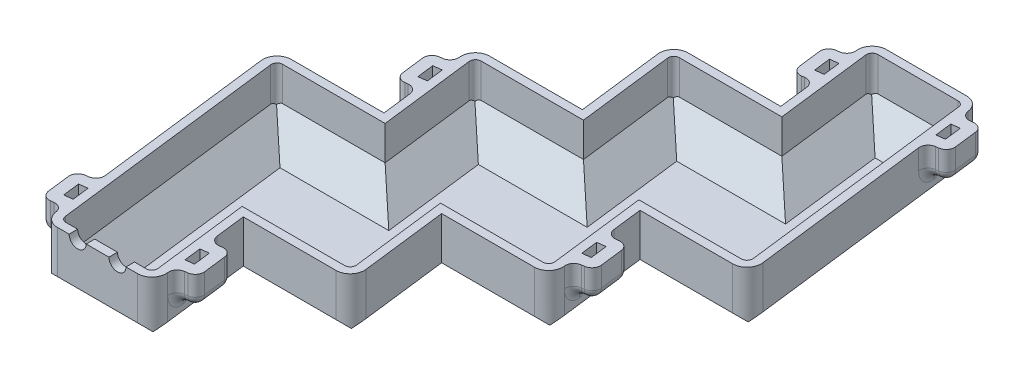
from build123d import *

# Parameters (mm, degrees)
BOSS_EXTRUDE1_DEPTH = 25
CUT_EXTRUDE1_DEPTH  = 22
CHAMFER1_SIZE       = 10
FILLET1_R           = 2
FILLET2_R           = 5
SKETCH5_W           = 14
SKETCH5_H           = 10.000000000000002
BOSS_EXTRUDE2_DEPTH = 7
BOSS_EXTRUDE3_DEPTH = 7
SKETCH7_W           = 14
SKETCH7_H           = 10.000000000000002
BOSS_EXTRUDE4_DEPTH = 7
BOSS_EXTRUDE5_DEPTH = 7
BOSS_EXTRUDE6_DEPTH = 7
BOSS_EXTRUDE7_DEPTH = 7
CUT_EXTRUDE2_DEPTH  = 152.6147278280595
FILLET3_R           = 3
SKETCH12_R          = 3.0000000000000084
CUT_EXTRUDE3_DEPTH  = 10
CUT_EXTRUDE4_DEPTH  = 1


with BuildPart() as part:
    # Sketch1 → Boss-Extrude1 (new body)
    with BuildSketch(Plane(origin=(0, 0, 0), x_dir=(1, 0, 0), z_dir=(0, 1, 0))):
        Polygon((-24.782157595776987, 46.15659644527007), (13.500561150506861, 46.156596445270075), (24.782157595776997, -46.15659644527006), (-13.50056115050686, -46.15659644527007), align=None)
        Polygon((58.678074332337594, -10.260994075450114), (20.395355586053746, -10.260994075450116), (9.11375914078362, 82.05219881509001), (47.39647788706746, 82.05219881509001), align=None)
        Polygon((-58.678074332337594, 10.260994075450114), (-20.395355586053743, 10.260994075450114), (-9.11375914078362, -82.05219881509002), (-47.396477887067455, -82.05219881509004), align=None)
        Polygon((-92.57399106889818, -25.634608294369865), (-54.29127232261435, -25.634608294369873), (-43.009675877344215, -117.94780118491), (-81.29239462362806, -117.94780118490999), align=None)
    extrude(amount=BOSS_EXTRUDE1_DEPTH)

    # Sketch4 → Cut-Extrude1 (cut)
    with BuildSketch(Plane(origin=(0, 25, 0), x_dir=(1, 0, 0), z_dir=(0, 1, 0))):
        Polygon((-55.28912439419859, 7.260994075450113), (-44.740788023161635, -79.05219881509001), (-12.50270907892256, -79.05219881509001), (-23.051045449959506, 7.26099407545012), align=None)
        Polygon((-16.889511088645808, -43.15659644527006), (-10.844871286601057, -43.15659644527007), (-17.006405647914757, 7.260994075450121), (-23.051045449959506, 7.26099407545012), align=None)
        Polygon((-21.39320765763801, 43.15659644527007), (10.844871286601068, 43.15659644527007), (21.393207657638005, -43.15659644527006), (-10.844871286601057, -43.15659644527007), align=None)
        Polygon((12.50270907892263, 79.05219881509), (44.74078802316171, 79.05219881509), (55.289124394198645, -7.260994075450106), (23.051045449959563, -7.260994075450112), align=None)
        Polygon((10.844871286601068, 43.156596445270075), (17.00640564791476, -7.260994075450107), (23.051045449959563, -7.260994075450112), (16.889511088645868, 43.15659644527008), align=None)
        Polygon((-89.18504113075915, -28.634608294369862), (-78.6367047597222, -114.94780118490999), (-46.39862581548313, -114.94780118490999), (-56.946962186520075, -28.634608294369865), align=None)
        Polygon((-50.78542782520637, -79.05219881509), (-44.740788023161635, -79.05219881509001), (-50.90232238447533, -28.63460829436987), (-56.946962186520075, -28.634608294369865), align=None)
    extrude(amount=-CUT_EXTRUDE1_DEPTH, mode=Mode.SUBTRACT)

    # Chamfer1
    chamfer1_edges = [part.edges().sort_by_distance(p)[0] for p in [
        (39.53671495919567, 0, 10.260994075450114),
        (22.588756590915374, 0, 28.208795260360084),
        (5.64079822263507, 0, 46.15659644527007),
        (-11.30716014564524, 0, 64.10439763018005),
        (-28.255118513925538, 0, 82.05219881509004),
        (-45.203076882205835, 0, 100.00000000000001),
        (-62.15103525048613, 0, 117.94780118490999),
        (-86.93319284626313, 0, 71.79120473963994),
        (-73.43263169575627, 0, 25.63460829436987),
        (-56.484673327475974, 0, 7.6868071094598776),
        (-39.53671495919567, 0, -10.260994075450114),
        (-22.588756590915366, 0, -28.20879526036009),
        (-5.640798222635063, 0, -46.15659644527007),
        (11.30716014564524, 0, -64.10439763018005),
        (28.255118513925538, 0, -82.05219881509001),
        (53.03727610970253, 0, -35.89560236981995),
        (-53.09572338933696, 3, 10.686807109459881),
        (50.014956208680175, 3, -35.89560236981995),
        (19.19980665277638, 3, 25.20879526036009),
        (-31.64406845206447, 3, 79.05219881509001),
        (-62.51766528760267, 3, 114.94780118490999),
        (-83.91087294524067, 3, 71.79120473963994),
        (-36.14776502105667, 3, -7.260994075450116),
        (-19.19980665277638, 3, -25.20879526036009),
        (-2.25184828449607, 3, -43.156596445270075),
        (14.69611008378425, 3, -61.10439763018003),
        (28.621748551042174, 3, -79.05219881509),
        (36.1477650210567, 3, 7.2609940754501086),
        (2.2518482844960985, 3, 43.15659644527007),
        (-14.696110083784184, 3, 61.10439763018003),
        (-48.592026820344756, 3, 96.99999999999999),
        (-70.04368175761724, 3, 28.634608294369865),
    ]]
    chamfer(chamfer1_edges, length=CHAMFER1_SIZE)

    # Fillet1
    fillet1_edges = [part.edges().sort_by_distance(p)[0] for p in [
        (-55.28912439419859, 19, -7.260994075450113),
        (-21.39320765763801, 19, -43.15659644527007),
        (12.50270907892263, 19, -79.05219881509),
        (44.74078802316171, 19, -79.05219881509),
        (55.289124394198645, 19, 7.260994075450106),
        (21.393207657638005, 19, 43.15659644527006),
        (-12.50270907892256, 19, 79.05219881509001),
        (-46.39862581548313, 19, 114.94780118490999),
        (-78.6367047597222, 19, 114.94780118490999),
        (-89.18504113075915, 19, 28.634608294369862),
    ]]
    fillet(fillet1_edges, radius=FILLET1_R)

    # Fillet2
    fillet2_edges = [part.edges().sort_by_distance(p)[0] for p in [
        (58.678074332337594, 17.5, 10.260994075450114),
        (24.782157595776997, 17.5, 46.15659644527006),
        (-9.11375914078362, 17.5, 82.05219881509002),
        (-43.009675877344215, 17.5, 117.94780118491),
        (-81.29239462362806, 17.5, 117.94780118490999),
        (-92.57399106889818, 17.5, 25.634608294369865),
        (-58.678074332337594, 17.5, -10.260994075450114),
        (-24.782157595776987, 17.5, -46.15659644527007),
        (9.11375914078362, 17.5, -82.05219881509001),
        (47.39647788706746, 17.5, -82.05219881509001),
    ]]
    fillet(fillet2_edges, radius=FILLET2_R)

    # Sketch5 → Boss-Extrude2 (add)
    with BuildSketch(Plane(origin=(56.579053707105224, 0, -6.914526853552663), x_dir=(-0.12130748865881867, 0, -0.9926149773176359), z_dir=(0.9926149773176359, 0, -0.12130748865881867))):
        with Locations((61.27054398877297, 20.000000000000004)):
            Rectangle(SKETCH5_W, SKETCH5_H)
    extrude(amount=BOSS_EXTRUDE2_DEPTH)

    # Sketch6 → Boss-Extrude3 (add)
    with BuildSketch(Plane(origin=(18.85968456903508, 0, -2.304842284517553), x_dir=(0.1213074886588186, 0, 0.9926149773176359), z_dir=(-0.9926149773176359, 0, 0.1213074886588186))):
        Polygon((-57.692424335194545, 15.000000000000004), (-71.69242433519454, 15.000000000000002), (-71.69242433519454, 25), (-57.692424335194545, 25), align=None)
    extrude(amount=BOSS_EXTRUDE3_DEPTH)

    # Sketch7 → Boss-Extrude4 (add)
    with BuildSketch(Plane(origin=(-94.29842284517535, 0, 11.524211422587761), x_dir=(0.12130748865881862, 0, 0.9926149773176359), z_dir=(-0.9926149773176359, 0, 0.12130748865881862))):
        with Locations((92.78922798579416, 20.000000000000004)):
            Rectangle(SKETCH7_W, SKETCH7_H)
    extrude(amount=BOSS_EXTRUDE4_DEPTH)

    # Sketch8 → Boss-Extrude5 (add)
    with BuildSketch(Plane(origin=(-56.57905370710522, 0, 6.914526853552657), x_dir=(-0.12130748865881859, 0, -0.9926149773176358), z_dir=(0.9926149773176358, 0, -0.12130748865881859))):
        Polygon((-89.2111083322157, 15), (-103.2111083322157, 14.999999999999998), (-103.2111083322157, 25), (-89.2111083322157, 25), align=None)
    extrude(amount=BOSS_EXTRUDE5_DEPTH)

    # Sketch9 → Boss-Extrude6 (add)
    with BuildSketch(Plane(origin=(18.85968456903508, 0, -2.3048422845175542), x_dir=(-0.12130748865881867, 0, -0.9926149773176359), z_dir=(0.9926149773176359, 0, -0.12130748865881867))):
        Polygon((-26.173740338173463, 15), (-40.17374033817346, 14.999999999999998), (-40.17374033817346, 25), (-26.173740338173463, 25), align=None)
    extrude(amount=BOSS_EXTRUDE6_DEPTH)

    # Sketch10 → Boss-Extrude7 (add)
    with BuildSketch(Plane(origin=(-56.57905370710522, 0, 6.914526853552661), x_dir=(0.12130748865881866, 0, 0.9926149773176358), z_dir=(-0.9926149773176358, 0, 0.12130748865881866))):
        Polygon((5.344943658847674, 15.000000000000005), (-8.655056341152326, 15.000000000000002), (-8.655056341152326, 25), (5.344943658847676, 25), align=None)
    extrude(amount=BOSS_EXTRUDE7_DEPTH)

    # Sketch11 → Cut-Extrude2 (cut, through all)
    with BuildSketch(Plane(origin=(0, 25, 0), x_dir=(1, 0, 0), z_dir=(0, 1, 0))):
        Polygon((-86.38416202155744, -101.01426638905134), (-83.40631708960454, -100.65034392307489), (-82.67847215765163, -106.6060337869807), (-85.65631708960456, -106.96995625295718), align=None)
        Polygon((-45.27184824021903, -99.43726903648665), (-42.294003308266106, -99.07334657051018), (-41.5661583763132, -105.02903643441603), (-44.54400330826612, -105.39295890039249), align=None)
        Polygon((-60.12159183336863, -2.657770675043866), (-57.14374690141571, -2.2938482090674075), (-56.415901969462794, -8.249538072973241), (-59.393746901415724, -8.613460538949703), align=None)
        Polygon((22.51998523290219, -27.64606429684674), (25.497830164855113, -27.28214183087028), (26.22567509680803, -33.23783169477611), (23.247830164855106, -33.60175416075258), align=None)
        Polygon((7.670241639752594, 69.13343406459603), (10.64808657170552, 69.49735653057249), (11.375931503658423, 63.54166666666665), (8.398086571705495, 63.17774420069019), align=None)
        Polygon((48.78255542109104, 70.71043141716069), (51.76040035304397, 71.07435388313714), (52.48824528499688, 65.1186640192313), (49.510400353043956, 64.75474155325485), align=None)
    extrude(amount=-CUT_EXTRUDE2_DEPTH, mode=Mode.SUBTRACT)

    # Fillet3
    fillet3_edges = [part.edges().sort_by_distance(p)[0] for p in [
        (-83.64893206692219, 15, 98.66511396843961),
        (-82.435857180334, 15, 108.59126374161596),
        (-90.83985188546328, 20, 97.52903643441604),
        (-87.36569946485156, 15, 97.10446022411018),
        (-83.89154704423983, 20, 96.67988401380433),
        (-89.99069946485155, 15, 104.4773412756395),
        (-89.14154704423981, 20, 111.42564611686296),
        (-85.6673946236281, 15, 111.00106990655708),
        (-82.19324220301637, 20, 110.57649369625122),
        (-44.05877335363086, 20, 109.363418809663),
        (-45.75707819485432, 20, 95.4668091272161),
        (23.733060119490382, 20, 37.57221407002309),
        (22.03475527826692, 20, 23.67560438757619),
        (49.99563030767923, 20, -60.78428164398431),
        (48.29732546645577, 20, -74.68089132643121),
        (11.861161458293715, 20, -59.57120675739611),
        (10.162856617070256, 20, -73.467816439843),
        (-57.62897685605099, 20, -1.6766117002031153),
        (-55.93067201482753, 20.000000000000004, 12.219997982243786),
        (-40.58462093301914, 14.999999999999998, 108.93884259935714),
        (-37.110468512407415, 20, 108.51426638905127),
        (-44.3013883309485, 14.999999999999998, 107.37818885502774),
        (-45.51446321753669, 15, 97.45203908185138),
        (-38.808773353630876, 20, 94.61765670660436),
        (-37.959620933019146, 15, 101.56596154782783),
        (-42.2829257742426, 15, 95.04223291691024),
        (30.681364960713832, 20, 36.723061649411356),
        (27.20721254010211, 14.999999999999998, 37.14763785971722),
        (23.490445142172746, 14.999999999999998, 35.58698411538783),
        (28.98306011949037, 20, 22.82645196696446),
        (29.832212540102102, 15, 29.77475680818791),
        (22.277370255584557, 15, 25.660834342211466),
        (25.508907698878648, 15, 23.251028177270324),
        (56.94393514890268, 20, -61.63343406459604),
        (53.46978272829095, 15, -61.20885785429017),
        (49.75301533036159, 15, -62.76951159861958),
        (48.5399404437734, 15, -72.69566137179595),
        (51.77147788706749, 15, -75.10546753673708),
        (56.09478272829095, 15, -68.58173890581949),
        (55.24563030767922, 20, -75.53004374704294),
        (4.912856617070266, 20, -58.72205433678438),
        (8.38700903768199, 15.000000000000004, -59.14663054709025),
        (4.063704196458535, 15.000000000000004, -65.67035917800783),
        (3.2145517758468056, 20, -72.61866401923128),
        (6.688704196458531, 15.000000000000002, -73.04324022953715),
        (10.40547159438789, 15.000000000000002, -71.48258648520775),
        (11.618546480976079, 15.000000000000004, -61.556436712031385),
        (-61.10312927666271, 15.000000000000002, -1.25203548989725),
        (-64.57728169727443, 20, -0.8274592795913849),
        (-57.386361878733354, 15.000000000000002, 0.3086182544321474),
        (-56.173286992145165, 15.000000000000005, 10.234768027608514),
        (-63.728129276662706, 15.000000000000004, 6.120845561632066),
        (-62.878976856050976, 20.000000000000004, 13.069150402855517),
        (-59.40482443543925, 15.000000000000005, 12.644574192549651),
    ]]
    fillet(fillet3_edges, radius=FILLET3_R - 0.0001)  # a hair under: the kernel refuses the full size

    # Sketch12 → Cut-Extrude3 (cut)
    with BuildSketch(Plane.XY.offset(117.94780118491002)):
        with Locations((-69.7620853123471, 25)):
            Circle(SKETCH12_R)
        with Locations((-55.76208531234708, 25)):
            Circle(SKETCH12_R)
    extrude(amount=-CUT_EXTRUDE3_DEPTH, mode=Mode.SUBTRACT)

    # Sketch13 → Cut-Extrude4 (cut)
    with BuildSketch(Plane(origin=(0, 0, -82.05219881509001), x_dir=(-1, 0, 0), z_dir=(0, 0, -1))):
        with BuildLine():
            Line((-27.56487566526923, 16.436277043639144), (-28.6221673319359, 16.436277043639144))
            add(Edge.make_bspline(
                [(-28.6221673319359, 16.436277043639144), (-28.69298045116643, 16.436429921966816), (-28.82853376034763, 16.436722567785043), (-29.023000390050782, 16.438417099643562), (-29.199432631989303, 16.443150140835535), (-29.358176145301023, 16.44728255328352), (-29.49907365136467, 16.454801517857167), (-29.62232790504526, 16.46185162608292), (-29.727582174740174, 16.471331278871677), (-29.791428509322184, 16.48001502252975), (-29.820384479371796, 16.483953325690425)],
                knots=[0, 0, 0, 0, 1.4163343391444694, 2.7112039218747905, 3.8894727718303947, 4.946381420146891, 5.88708687916243, 6.711376891967713, 7.415575970559514, 8, 8, 8, 8], degree=3))
            add(Edge.make_bspline(
                [(-29.820384479371796, 16.483953325690425), (-29.859038697882255, 16.49025225756395), (-29.934910107421302, 16.502615949244984), (-30.045053567020712, 16.528965895524475), (-30.14972434724127, 16.559686656740645), (-30.248982701412697, 16.595258128443568), (-30.342347417955562, 16.636758061360148), (-30.4303618077622, 16.683240529335656), (-30.513110685601884, 16.73412884036294), (-30.589770354544264, 16.790153670592726), (-30.658715610081035, 16.850729619131698), (-30.719702692172397, 16.914514560341296), (-30.770921468732936, 16.982466590888887), (-30.811825980791884, 17.054234335205546), (-30.845925480196158, 17.12845048054959), (-30.86888439743353, 17.206841837371663), (-30.882277899911454, 17.28861333646604), (-30.884343923818456, 17.34418044181364), (-30.88538848578205, 17.37227463979299)],
                knots=[0, 0, 0, 0, 1.2418907094695326, 2.4376123034386277, 3.589300094479396, 4.700802967128722, 5.779385907081064, 6.827242204158732, 7.8558322642213305, 8.858121559606808, 9.835118102444337, 10.763281839861085, 11.652840032450703, 12.526346368987856, 13.37912966087586, 14.237564839422033, 15.108929608312378, 16, 16, 16, 16], degree=3))
            add(Edge.make_bspline(
                [(-30.88538848578205, 17.37227463979299), (-30.884681938849866, 17.395914141047243), (-30.883283718383026, 17.442695512494552), (-30.873123667748054, 17.511713222384994), (-30.857154949391713, 17.57844379178357), (-30.8344147511526, 17.643072048386106), (-30.80503545795198, 17.70532799250105), (-30.768646991100827, 17.76535444126798), (-30.726790623382076, 17.823569823757513), (-30.67811388801221, 17.879115079496557), (-30.62319533216825, 17.931563020111223), (-30.5629056441748, 17.981476308331263), (-30.49671376299067, 18.02775171688217), (-30.424997116034756, 18.070592066948322), (-30.347487274294117, 18.109695746485023), (-30.264929631099815, 18.146113623564545), (-30.176728994044275, 18.17924240531397), (-30.082396351791324, 18.208715712922434), (-29.980316428154882, 18.23465199751547), (-29.86999410565826, 18.25790276341777), (-29.750070746366376, 18.27630423336079), (-29.62128063017239, 18.292557802990878), (-29.483065655036683, 18.304969250188478), (-29.33577116604448, 18.31394929195092), (-29.179369265735247, 18.319617060787518), (-29.07205874032809, 18.320459431975735), (-29.01689890244872, 18.320892428254528)],
                knots=[0, 0, 0, 0, 0.7323391168272213, 1.4492618892934046, 2.157129361619398, 2.855711579249908, 3.568415503835773, 4.286288666363027, 5.02798542399544, 5.787603267966053, 6.571248040286719, 7.378886803275351, 8.210678650034964, 9.07138214411302, 9.965294252001215, 10.899149031125027, 11.866276500870281, 12.883257392887769, 13.959981898347793, 15.12891109836355, 16.375484438926165, 17.718384990195965, 19.15100465839435, 20.67473878226197, 22.290746699999392, 24, 24, 24, 24], degree=3))
            Line((-29.01689890244872, 18.320892428254528), (-30.930260280653847, 19.936277043639144))
            Line((-30.930260280653847, 19.936277043639144), (-30.29925066526923, 19.936277043639144))
            Line((-30.29925066526923, 19.936277043639144), (-28.385889287064106, 18.320892428254528))
            Line((-28.385889287064106, 18.320892428254528), (-28.058465408858975, 18.320892428254528))
            Line((-28.058465408858975, 18.320892428254528), (-28.058465408858975, 19.936277043639144))
            Line((-28.058465408858975, 19.936277043639144), (-27.56487566526923, 19.936277043639144))
            Line((-27.56487566526923, 19.936277043639144), (-27.56487566526923, 16.436277043639144))
        make_face()
        with BuildLine():
            Line((-28.058465408858975, 16.795251402613502), (-28.058465408858975, 17.96191806928017))
            Line((-28.058465408858975, 17.96191806928017), (-29.010588806294876, 17.96682592184427))
            add(Edge.make_bspline(
                [(-29.010588806294876, 17.96682592184427), (-29.05523069719388, 17.96684277696285), (-29.141491865453464, 17.96687534597349), (-29.2662905137678, 17.962860004082753), (-29.382020216633283, 17.958364622568908), (-29.48885943150921, 17.95134581932653), (-29.586843815376838, 17.94241972058122), (-29.675953608427815, 17.93131319636719), (-29.756018614970717, 17.91825961125689), (-29.848632496662585, 17.897984095260043), (-29.95253504892753, 17.868336146820383), (-30.063633437868923, 17.819780445255486), (-30.161893444476817, 17.76395525689699), (-30.24298671083912, 17.696030504065828), (-30.309612289577256, 17.622963586714885), (-30.35643429875272, 17.543142707942835), (-30.38692460371473, 17.459030868039402), (-30.39016953909719, 17.400806537542703), (-30.391798742192307, 17.37157351799812)],
                knots=[0, 0, 0, 0, 1.2943559936305231, 2.5010737203527924, 3.6202251083480026, 4.652501150408967, 5.605312167847274, 6.472748567979781, 7.255941721957364, 7.956431307489908, 9.221504959871156, 10.380944310482741, 11.46531260192184, 12.485686489501832, 13.43620538154865, 14.317168590979872, 15.155091298595172, 16, 16, 16, 16], degree=3))
            add(Edge.make_bspline(
                [(-30.391798742192307, 17.37157351799812), (-30.390179489118903, 17.3432614653147), (-30.386922362317197, 17.286311784550602), (-30.355692650009956, 17.20441848596958), (-30.308439075227398, 17.12611786456033), (-30.24202813639303, 17.054178238938388), (-30.160677618386085, 16.98942622130382), (-30.06657557062877, 16.933955075462382), (-29.96101650249561, 16.88843716745195), (-29.864257935865858, 16.858467029174072), (-29.77720206458949, 16.84046509940169), (-29.700801058336378, 16.827592622508767), (-29.613881798954857, 16.818524301966477), (-29.517117307313164, 16.810071606848343), (-29.410532962407416, 16.80301988101059), (-29.29387957710149, 16.798272040446673), (-29.166953275629204, 16.795455008789354), (-29.078832877565358, 16.79532104292225), (-29.033024703730774, 16.795251402613502)],
                knots=[0, 0, 0, 0, 0.8340809480984482, 1.6777534379712602, 2.5582876304304607, 3.5270041533033822, 4.554401853459536, 5.623369790159775, 6.746704154938878, 7.946721152405147, 8.61082392242669, 9.374241616330773, 10.236555795072652, 11.193767905326371, 12.246395517244467, 13.394515313702845, 14.645574713056057, 16, 16, 16, 16], degree=3))
            Line((-29.033024703730774, 16.795251402613502), (-28.058465408858975, 16.795251402613502))
        make_face(mode=Mode.SUBTRACT)
    extrude(amount=-CUT_EXTRUDE4_DEPTH, mode=Mode.SUBTRACT)


solid = part.part
